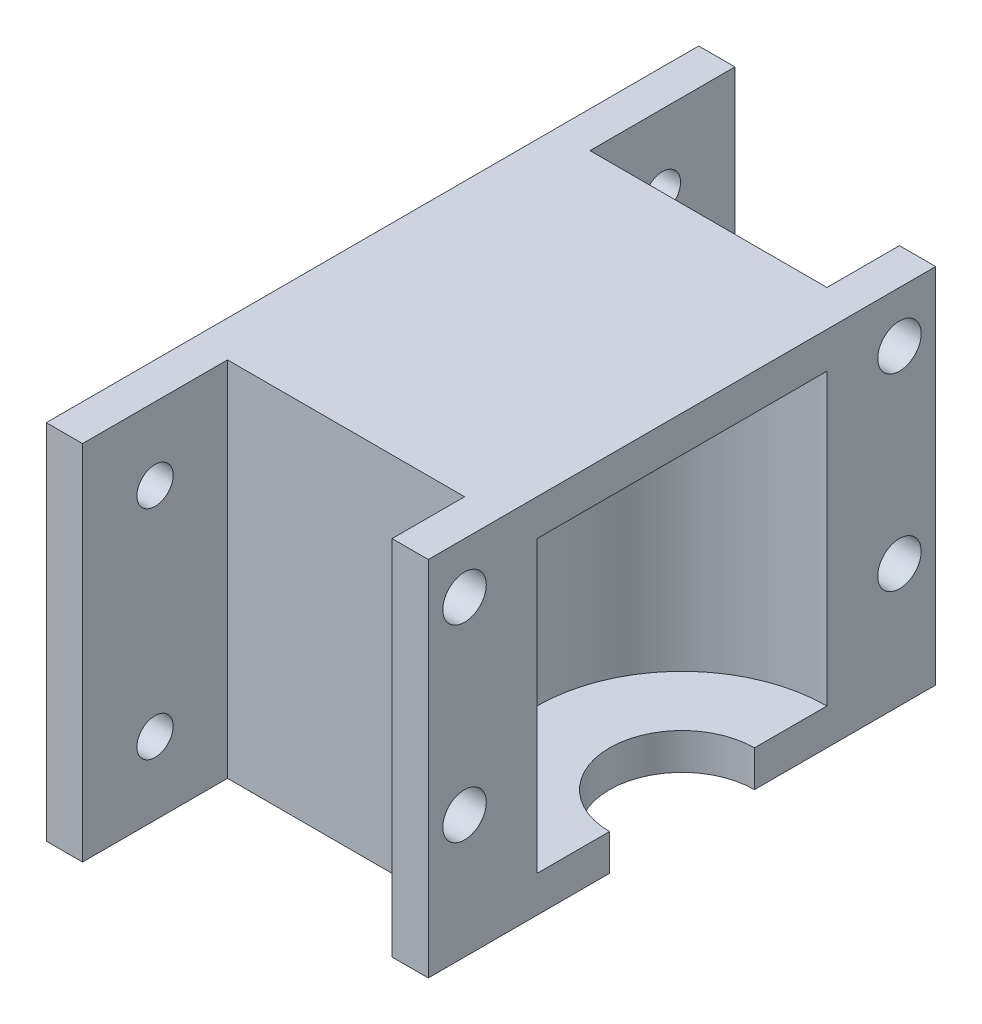
from build123d import *

# Parameters (mm, degrees)
SKETCH1_W           = 50
SKETCH1_H           = 50
BOSS_EXTRUDE1_DEPTH = 50
CAVITY1_START       = 5
CAVITY1_DEPTH       = 40
CAVITY1_2_DEPTH     = 5
CUT_EXTRUDE3_REACH  = 72.343
SKETCH6_W           = 50
SKETCH6_H           = 50
SKETCH4_W           = 20
SKETCH4_H           = 50
BOSS_EXTRUDE2_DEPTH = 5
SKETCH5_R           = 2.5
CUT_EXTRUDE2_DEPTH  = 5
SKETCH7_W           = 10
SKETCH7_H           = 50
SKETCH7_R           = 3
BOSS_EXTRUDE3_DEPTH = 5


# Read off the part's stored shape, not the designer's step: Cavity1
with BuildPart() as part:
    # Sketch1 → Boss-Extrude1 (new body)
    with BuildSketch(Plane(origin=(0, 0, 0), x_dir=(1, 0, 0), z_dir=(0, 1, 0))):
        Rectangle(SKETCH1_W, SKETCH1_H)
    extrude(amount=BOSS_EXTRUDE1_DEPTH)

    # Cavity1 outline → Cavity1 (cut)
    with BuildSketch(Plane(origin=(0, 0, 0), x_dir=(1, 0, 0), z_dir=(0, 1, 0)).offset(CAVITY1_START)):
        with BuildLine():
            ThreePointArc((25, 18.619634446), (-2.301315846, 0), (25, -18.619634446))
            Line((25, -18.619634446), (25, 18.619634446))
        make_face()
    extrude(amount=CAVITY1_DEPTH, mode=Mode.SUBTRACT)

    # Cavity1 2 outline → Cavity1 2 (cut)
    with BuildSketch(Plane(origin=(0, 0, 0), x_dir=(1, 0, 0), z_dir=(0, 1, 0))):
        with BuildLine():
            Line((25, -6.833065704), (25, 6.833065704))
            ThreePointArc((25, 6.833065704), (7.698684154, 0), (25, -6.833065704))
        make_face()
    extrude(amount=CAVITY1_2_DEPTH, mode=Mode.SUBTRACT)

    # Sketch6 → Cut-Extrude3 (cut, up to next)
    with BuildSketch(Plane.ZY.offset(-17.698684154), mode=Mode.PRIVATE) as cut_extrude3_sk1:
        with Locations((0, 25)):
            Rectangle(SKETCH6_W, SKETCH6_H)
    cut_extrude3_tool1 = extrude(cut_extrude3_sk1.sketch, amount=-CUT_EXTRUDE3_REACH, mode=Mode.PRIVATE) & part.part
    add(cut_extrude3_tool1.solids().sort_by_distance((17.698684, 25, 0))[0], mode=Mode.SUBTRACT)

    # Sketch4 → Boss-Extrude2 (add)
    with BuildSketch(Plane.ZY.offset(25)):
        with Locations((-35, 25)):
            Rectangle(SKETCH4_W, SKETCH4_H)
        with Locations((35, 25)):
            Rectangle(SKETCH4_W, SKETCH4_H)
    extrude(amount=-BOSS_EXTRUDE2_DEPTH)

    # Sketch5 → Cut-Extrude2 (cut)
    with BuildSketch(Plane(origin=(-20, 0, 0), x_dir=(0, 0, -1), z_dir=(1, 0, 0))):
        with Locations((-35, 40)):
            Circle(SKETCH5_R)
        with Locations((-35, 10)):
            Circle(SKETCH5_R)
    cut_extrude2 = extrude(amount=-CUT_EXTRUDE2_DEPTH, mode=Mode.SUBTRACT)

    # Mirror1: Cut-Extrude2 across plane
    add(cut_extrude2.mirror(Plane.XY), mode=Mode.SUBTRACT)

    # Sketch7 → Boss-Extrude3 (add)
    # profile 1 of 2: a face of its own
    with BuildSketch(Plane(origin=(17.698684154, 0, 0), x_dir=(0, 0, -1), z_dir=(1, 0, 0))):
        with Locations((-30, 25)):
            Rectangle(SKETCH7_W, SKETCH7_H)
        with Locations((-30, 17)):
            Circle(SKETCH7_R, mode=Mode.SUBTRACT)
        with Locations((-30, 43)):
            Circle(SKETCH7_R, mode=Mode.SUBTRACT)
    # profile 2 of 2: a face of its own
    with BuildSketch(Plane(origin=(17.698684154, 0, 0), x_dir=(0, 0, -1), z_dir=(1, 0, 0))):
        with Locations((30, 25)):
            Rectangle(SKETCH7_W, SKETCH7_H)
        with Locations((30, 43)):
            Circle(SKETCH7_R, mode=Mode.SUBTRACT)
        with Locations((30, 17)):
            Circle(SKETCH7_R, mode=Mode.SUBTRACT)
    extrude(amount=-BOSS_EXTRUDE3_DEPTH)


solid = part.part
